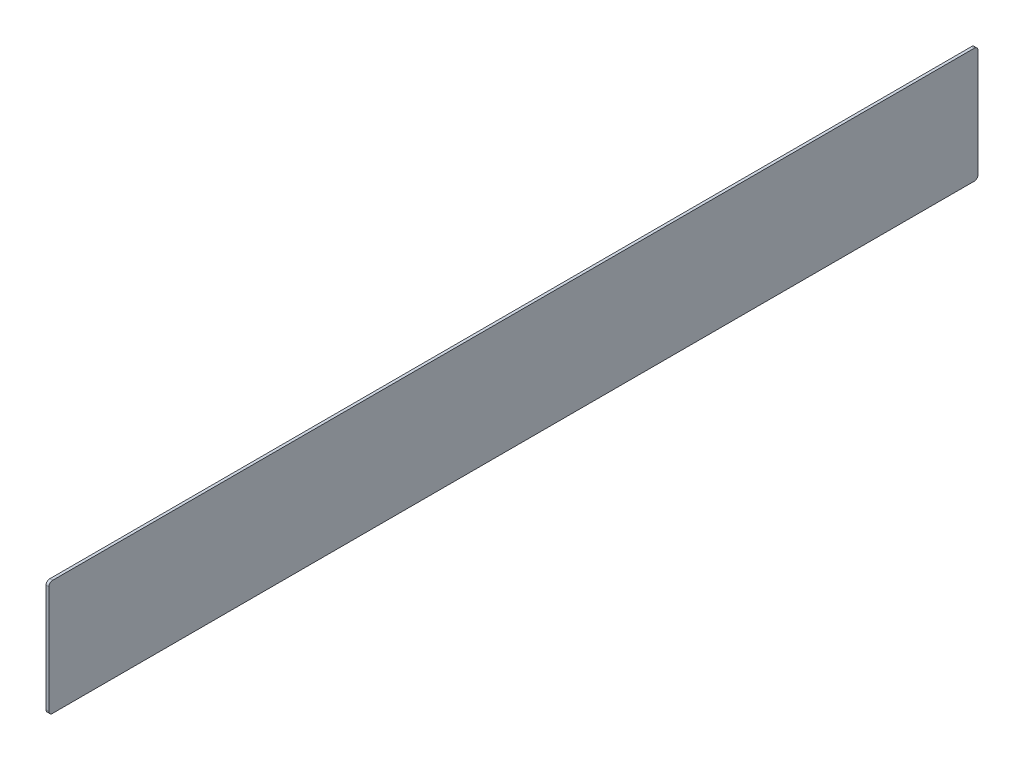
from build123d import *

# Parameters (mm, degrees)
SKETCH1_W           = 500
SKETCH1_H           = 62
BOSS_EXTRUDE1_DEPTH = 1.5
FILLET1_R           = 2


with BuildPart() as part:
    # Sketch1 → Boss-Extrude1 (new body)
    with BuildSketch(Plane(origin=(0, 0, 0), x_dir=(0, 0, -1), z_dir=(1, 0, 0))):
        with Locations((-19.946808511, -109.292553191)):
            Rectangle(SKETCH1_W, SKETCH1_H)
    extrude(amount=BOSS_EXTRUDE1_DEPTH)

    # Fillet1
    fillet1_edges = [part.edges().sort_by_distance(p)[0] for p in [
        (0.75, -140.292553191, -230.053191489),
        (0.75, -78.292553191, -230.053191489),
        (0.75, -140.292553191, 269.946808511),
        (0.75, -78.292553191, 269.946808511),
    ]]
    fillet(fillet1_edges, radius=FILLET1_R)


solid = part.part
